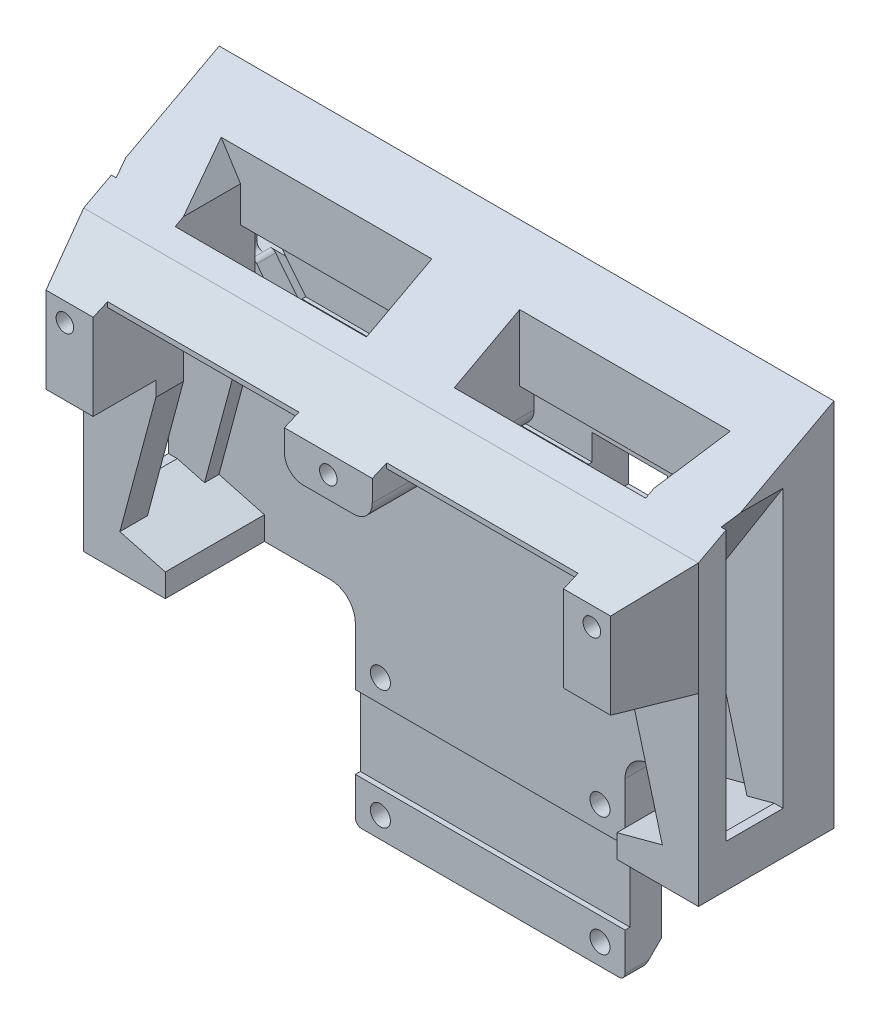
from build123d import *

# Parameters (mm, degrees)
EXTRUDE_1_DEPTH      = 10
EXTRUDE_7_DEPTH      = 11.6
FILLET_4_R           = 4
EXTRUDE_12_REACH     = 142.896
CUT_EXTRUDE_1_DEPTH  = 98
CUT_EXTRUDE_2_DEPTH  = 7.2
CUT_EXTRUDE_START    = -1.9
CUT_EXTRUDE_3_DEPTH  = 1.9
CUT_EXTRUDE_4_DEPTH  = 2.3
CUT_EXTRUDE_5_DEPTH  = 35
SKETCH_19_W          = 12
SKETCH_19_H          = 10
CUT_EXTRUDE_6_DEPTH  = 10
CUT_EXTRUDE_START_2  = -98
CUT_EXTRUDE_9_DEPTH  = 98
SKETCH_21_W          = 11
SKETCH_21_H          = 16
CUT_EXTRUDE_10_DEPTH = 4
SKETCH_22_W          = 4
SKETCH_22_H          = 6
CUT_EXTRUDE_11_DEPTH = 1.8
CUT_EXTRUDE_12_DEPTH = 3
FILLET_5_R           = 2
SKETCH_25_R          = 1.4
SKETCH_25_R_2        = 1.5
CUT_EXTRUDE_14_DEPTH = 5
FILLET_7_R           = 3
FILLET_8_R           = 1
FILLET_9_R           = 1
SKETCH_26_W          = 57.254707828
SKETCH_26_H          = 60.630906816
CUT_EXTRUDE_15_DEPTH = 34
SKETCH_27_W          = 38.751379921
SKETCH_27_H          = 18.149380469
CUT_EXTRUDE_16_DEPTH = 90
SKETCH_28_W          = 43
SKETCH_28_H          = 11.7
CUT_EXTRUDE_17_DEPTH = 0.8
SKETCH_29_R          = 1.6
CUT_EXTRUDE_18_DEPTH = 10
SKETCH_30_R          = 3.1
CUT_EXTRUDE_19_DEPTH = 3
CUT_EXTRUDE_20_REACH = 122.97
EXTRUDE_START        = 10
SKETCH_32_R          = 1.4
EXTRUDE_13_DEPTH     = 10
CUT_EXTRUDE_21_DEPTH = 105
SKETCH_35_W          = 11.6
SKETCH_35_H          = 2.5
EXTRUDE_14_DEPTH     = 13.009720114
SKETCH_36_W          = 11.6
SKETCH_36_H          = 2.5
EXTRUDE_15_DEPTH     = 13.009720114
CUT_EXTRUDE_23_DEPTH = 22
FILLET_10_R          = 1
SKETCH_41_W          = 26.831763834
SKETCH_41_H          = 0.8
EXTRUDE_16_DEPTH     = 0.4
SKETCH_42_W          = 30.5
SKETCH_42_H          = 4.57900939
CUT_EXTRUDE_26_DEPTH = 12
SKETCH_43_W          = 30.5
SKETCH_43_H          = 0.8
EXTRUDE_17_DEPTH     = 11.089944
SKETCH_44_W          = 30.5
SKETCH_44_H          = 0.8
EXTRUDE_18_DEPTH     = 11.089944
CUT_EXTRUDE_27_REACH = 114.234
EXTRUDE_19_DEPTH     = 0.6


# Read off the part's stored shape, not the designer's step: Вырез-Вытянуть2, Вырез-Вытянуть3
with BuildPart() as part:
    # Эскиз1 → Бобышка-Вытянуть1 (new body)
    with BuildSketch(Plane.XY):
        with BuildLine():
            Line((21.5, 0), (-21.5, 0))
            Line((-21.5, 0), (-21.5, 32.9))
            ThreePointArc((-21.5, 32.9), (-22.671572875, 35.728427125), (-25.5, 36.9))
            Line((-25.5, 36.9), (-49, 36.9))
            Line((-49, 36.9), (-49, 98.9))
            Line((-49, 98.9), (0, 98.9))
            Line((0, 98.9), (49, 98.9))
            Line((49, 98.9), (49, 36.9))
            Line((49, 36.9), (25.5, 36.9))
            ThreePointArc((25.5, 36.9), (22.671572875, 35.728427125), (21.5, 32.9))
            Line((21.5, 32.9), (21.5, 0))
        make_face()
    extrude(amount=EXTRUDE_1_DEPTH)

    # Эскиз11 → Бобышка-Вытянуть7 (add)
    with BuildSketch(Plane.XY.offset(10)):
        Polygon((21.553165826, 42.9), (-21.553165826, 42.9), (-21.553165826, 39.55), (-16, 39.55), (-16, 34.55), (16, 34.55), (16, 39.55), (21.553165826, 39.55), align=None)
    extrude(amount=EXTRUDE_7_DEPTH)

    # Скругление4
    fillet_4_edges = [part.edges().sort_by_distance(p)[0] for p in [
        (21.5, 0, 5),
        (-21.5, 0, 5),
    ]]
    fillet(fillet_4_edges, radius=FILLET_4_R)

    # Бобышка-Вытянуть12: up to this face of the body (flat: up to its plane)
    extrude_12_end = Plane(part.part.faces().sort_by_distance((49, 67.9, 5))[0])
    # Эскиз15 → Бобышка-Вытянуть12 (add, up to the picked face)
    with BuildSketch(Plane.ZY.offset(49), mode=Mode.PRIVATE) as extrude_12_sk1:
        Polygon((10, 92.154914832), (21.6, 84.330616036), (21.6, 39.4), (10, 39.4), align=None)
    extrude_12_tool1 = split(extrude(extrude_12_sk1.sketch, amount=-EXTRUDE_12_REACH, mode=Mode.PRIVATE), bisect_by=extrude_12_end, keep=Keep.BOTH, mode=Mode.PRIVATE)
    add(extrude_12_tool1.solids().sort_by(Axis((-49, 63.873608, 15.645146), (1, 0, 0)))[0])

    # Эскиз16 → Вырез-Вытянуть1 (cut)
    with BuildSketch(Plane.ZY.offset(49)):
        Polygon((0, 98.9), (10, 92.154914832), (12.130281991, 92.154914832), (12.130281991, 101.596000438), (0, 101.596000438), align=None)
    extrude(amount=-CUT_EXTRUDE_1_DEPTH, mode=Mode.SUBTRACT)

    # Вырез-Вытянуть2 outline → Вырез-Вытянуть2 (cut)
    with BuildSketch(Plane.XY.offset(10)):
        Polygon((7, 74.682330798), (37.5, 74.682330798), (37.5, 86.682330798), (51.448996139, 108.780541488), (7, 108.780541488), align=None)
        Polygon((35.990279886, 40.593813782), (47.581389801, 43.699642323), (49, 43.699642323), (49, 87.913527677), (39.687408926, 73.160380025), (27.264094761, 73.160380025), align=None)
        Polygon((-47.581389801, 43.699642323), (-35.990279886, 40.593813782), (-27.264094761, 73.160380025), (-39.687408926, 73.160380025), (-49, 87.913527677), (-49, 43.699642323), align=None)
        Polygon((-7, 108.780541488), (-51.448996139, 108.780541488), (-37.5, 86.682330798), (-37.5, 74.682330798), (-7, 74.682330798), align=None)
    extrude(amount=CUT_EXTRUDE_2_DEPTH, mode=Mode.SUBTRACT)

    # Вырез-Вытянуть3 outline → Вырез-Вытянуть3 (cut)
    with BuildSketch(Plane.XY.offset(10).offset(CUT_EXTRUDE_START)):
        Polygon((7, 74.682330798), (37.5, 74.682330798), (37.5, 86.682330798), (51.448996139, 108.780541488), (7, 108.780541488), align=None)
        Polygon((35.990279886, 40.593813782), (47.581389801, 43.699642323), (53.004518146, 43.699642323), (53.004518146, 94.2575459), (39.687408926, 73.160380025), (27.264094761, 73.160380025), align=None)
        Polygon((-47.581389801, 43.699642323), (-35.990279886, 40.593813782), (-27.264094761, 73.160380025), (-39.687408926, 73.160380025), (-53.004518146, 94.2575459), (-53.004518146, 43.699642323), align=None)
        Polygon((-7, 108.780541488), (-51.448996139, 108.780541488), (-37.5, 86.682330798), (-37.5, 74.682330798), (-7, 74.682330798), align=None)
    extrude(amount=CUT_EXTRUDE_3_DEPTH, mode=Mode.SUBTRACT)

    # Эскиз18 → Вырез-Вытянуть4 (cut)
    with BuildSketch(Plane.XY.offset(8.1)):
        Polygon((7, 81), (37.5, 81), (37.5, 63.9372364), (43.234723583, 42.53495662), (35.990279886, 40.593813782), (35.990279886, 33.432094285), (16, 33.432094285), (16, 42.55), (-16, 42.55), (-16, 33.432094285), (-35.990279886, 33.432094285), (-35.990279886, 40.593813782), (-43.234723583, 42.53495662), (-37.5, 63.9372364), (-37.5, 81), (-7, 81), (-7, 73.58), (7, 73.58), align=None)
    extrude(amount=-CUT_EXTRUDE_4_DEPTH, mode=Mode.SUBTRACT)

    # Эскиз18 → Вырез-Вытянуть5 (cut)
    with BuildSketch(Plane.XY.offset(8.1)):
        Polygon((7, 81), (37.5, 81), (37.5, 63.9372364), (43.234723583, 42.53495662), (35.990279886, 40.593813782), (35.990279886, 33.432094285), (16, 33.432094285), (16, 42.55), (-16, 42.55), (-16, 33.432094285), (-35.990279886, 33.432094285), (-35.990279886, 40.593813782), (-43.234723583, 42.53495662), (-37.5, 63.9372364), (-37.5, 81), (-7, 81), (-7, 73.58), (7, 73.58), align=None)
    extrude(amount=CUT_EXTRUDE_5_DEPTH, mode=Mode.SUBTRACT)

    # Эскиз19 → Вырез-Вытянуть6 (cut)
    with BuildSketch(Plane.XY.offset(5.8)):
        Polygon((32.42222683, 61.637375681), (34.354078483, 62.155013771), (37.459907024, 50.563903856), (35.528055371, 50.046265766), (28.283611674, 48.105122927), (25.177783133, 59.696232843), align=None)
        with Locations((22.25, 73.08)):
            Rectangle(SKETCH_19_W, SKETCH_19_H)
    extrude(amount=-CUT_EXTRUDE_6_DEPTH, mode=Mode.SUBTRACT)

    # Эскиз20 → Вырез-Вытянуть9 (cut)
    with BuildSketch(Plane.ZY.offset(49).offset(CUT_EXTRUDE_START_2)):
        Polygon((0, 95.9), (21.6, 84.330616036), (21.6, 100.647071041), (-4.292074311, 100.647071041), (-4.292074311, 95.9), align=None)
    extrude(amount=CUT_EXTRUDE_9_DEPTH, mode=Mode.SUBTRACT)

    # Эскиз21 → Вырез-Вытянуть10 (cut)
    with BuildSketch(Plane(origin=(0, 0, 0), x_dir=(-1, 0, 0), z_dir=(0, 0, -1))):
        with Locations((40.5, 83)):
            Rectangle(SKETCH_21_W, SKETCH_21_H)
        with Locations((-40.5, 83)):
            Rectangle(SKETCH_21_W, SKETCH_21_H)
    extrude(amount=-CUT_EXTRUDE_10_DEPTH, mode=Mode.SUBTRACT)

    # Эскиз22 → Вырез-Вытянуть11 (cut)
    with BuildSketch(Plane(origin=(0, 0, 4), x_dir=(-1, 0, 0), z_dir=(0, 0, -1))):
        with Locations((37, 78)):
            Rectangle(SKETCH_22_W, SKETCH_22_H)
        with Locations((-37, 78)):
            Rectangle(SKETCH_22_W, SKETCH_22_H)
    extrude(amount=-CUT_EXTRUDE_11_DEPTH, mode=Mode.SUBTRACT)

    # Эскиз23 → Вырез-Вытянуть12 (cut)
    with BuildSketch(Plane.XY.offset(5.8)):
        Polygon((35, 75), (35, 81), (28.25, 72.541381211), (28.25, 68.08), (24.689806081, 68.08), (22.25, 65.022608954), (26.702577765, 61.469440209), (37.5, 75), align=None)
        Polygon((-35, 81), (-22.25, 65.022608954), (-26.702577765, 61.469440209), (-37.5, 75), (-35, 75), align=None)
    extrude(amount=-CUT_EXTRUDE_12_DEPTH, mode=Mode.SUBTRACT)

    # Скругление5
    fillet_5_edges = [part.edges().sort_by_distance(p)[0] for p in [
        (24.476288882, 63.246024582, 2.8),
        (-24.476288882, 63.246024582, 2.8),
    ]]
    fillet(fillet_5_edges, radius=FILLET_5_R)

    # Эскиз25 → Вырез-Вытянуть14 (cut)
    with BuildSketch(Plane.XY.offset(21.6)):
        with Locations((-42, 77)):
            Circle(SKETCH_25_R)
        with Locations((0, 77)):
            Circle(SKETCH_25_R)
        with Locations((-11, 7.5)):
            Circle(SKETCH_25_R_2)
        with Locations((11, 7.5)):
            Circle(SKETCH_25_R_2)
        with Locations(Location((42, 77, 0), (0, 0, 53.891575988))):
            Circle(SKETCH_25_R)
    extrude(amount=-CUT_EXTRUDE_14_DEPTH, mode=Mode.SUBTRACT)

    # Скругление7
    fillet_7_edges = [part.edges().sort_by_distance(p)[0] for p in [
        (7, 73.58, 13.7),
        (-7, 73.58, 13.7),
    ]]
    fillet(fillet_7_edges, radius=FILLET_7_R)

    # Скругление8
    # the kernel refuses this fillet: 1 mm, written as the material it adds along each edge
    with BuildSketch(Plane(origin=(35, 81, 4), x_dir=(1, 0, 0), z_dir=(0, 0, 1))) as fillet_8_piece_1:
        with BuildLine():
            CenterArc((FILLET_8_R * 0.481375422806, -FILLET_8_R), FILLET_8_R, 90, 51.41004095)
            Line((-FILLET_8_R * 0.30025437104, -FILLET_8_R * 0.37625737249), (0, 0))
            Line((0, 0), (FILLET_8_R * 0.481375422806, 0))
        make_face()
    extrude(amount=1.8)
    with BuildSketch(Plane(origin=(39, 81, 4), x_dir=(-1, 0, 0), z_dir=(0, 0, 1))) as fillet_8_piece_2:
        with BuildLine():
            CenterArc((FILLET_8_R, FILLET_8_R), FILLET_8_R, 180, 90)
            Line((0, FILLET_8_R), (0, 0))
            Line((0, 0), (FILLET_8_R, 0))
        make_face()
    extrude(amount=4.3)
    with BuildSketch(Plane(origin=(35, 75, 0), x_dir=(0, 1, 0), z_dir=(0, 0, 1))) as fillet_8_piece_3:
        with BuildLine():
            CenterArc((FILLET_8_R, -FILLET_8_R), FILLET_8_R, 90, 90)
            Line((0, -FILLET_8_R), (0, 0))
            Line((0, 0), (FILLET_8_R, 0))
        make_face()
    extrude(amount=2.8)
    with BuildSketch(Plane(origin=(46, 75, 0), x_dir=(-1, 0, 0), z_dir=(0, 0, 1))) as fillet_8_piece_4:
        with BuildLine():
            CenterArc((FILLET_8_R, -FILLET_8_R), FILLET_8_R, 90, 90)
            Line((0, -FILLET_8_R), (0, 0))
            Line((0, 0), (FILLET_8_R, 0))
        make_face()
    extrude(amount=6.5)
    with BuildSketch(Plane(origin=(35, 91, 0), x_dir=(0, -1, 0), z_dir=(0, 0, 1)), Plane(origin=(46, 91, 0), x_dir=(-1, 0, 0), z_dir=(0, 0, 1))) as fillet_8_piece_5:
        with BuildLine():
            CenterArc((FILLET_8_R, FILLET_8_R), FILLET_8_R, 180, 90)
            Line((0, FILLET_8_R), (0, 0))
            Line((0, 0), (FILLET_8_R, 0))
        make_face()
    extrude(amount=6.5)
    # the kernel refuses this fillet: 1 mm, written as the material it takes off along each edge
    with BuildSketch(Plane(origin=(37.5, 75, 5.8), x_dir=(1, 0, 0), z_dir=(0, 0, -1))) as fillet_8_2_piece_1:
        with BuildLine():
            CenterArc((FILLET_8_R * 0.481375422806, FILLET_8_R), FILLET_8_R, 218.58995905, 51.41004095)
            Line((-FILLET_8_R * 0.30025437104, FILLET_8_R * 0.37625737249), (0, 0))
            Line((0, 0), (FILLET_8_R * 0.481375422806, 0))
        make_face()
    extrude(amount=3, mode=Mode.SUBTRACT)

    # Скругление9
    # the kernel refuses this fillet: 1 mm, written as the material it adds along each edge
    with BuildSketch(Plane(origin=(39, 75, 4), x_dir=(-1, 0, 0), z_dir=(0, 0, 1)), Plane(origin=(-39, 81, 4), x_dir=(1, 0, 0), z_dir=(0, 0, 1))) as fillet_9_piece_1:
        with BuildLine():
            CenterArc((FILLET_9_R, -FILLET_9_R), FILLET_9_R, 90, 90)
            Line((0, -FILLET_9_R), (0, 0))
            Line((0, 0), (FILLET_9_R, 0))
        make_face()
    extrude(amount=4.3)
    with BuildSketch(Plane(origin=(-35, 81, 4), x_dir=(-1, 0, 0), z_dir=(0, 0, 1))) as fillet_9_piece_2:
        with BuildLine():
            CenterArc((FILLET_9_R * 0.481375422806, FILLET_9_R), FILLET_9_R, 218.58995905, 51.41004095)
            Line((-FILLET_9_R * 0.30025437104, FILLET_9_R * 0.37625737249), (0, 0))
            Line((0, 0), (FILLET_9_R * 0.481375422806, 0))
        make_face()
    extrude(amount=1.8)
    with BuildSketch(Plane(origin=(-39, 75, 4), x_dir=(1, 0, 0), z_dir=(0, 0, 1))) as fillet_9_piece_3:
        with BuildLine():
            CenterArc((FILLET_9_R, FILLET_9_R), FILLET_9_R, 180, 90)
            Line((0, FILLET_9_R), (0, 0))
            Line((0, 0), (FILLET_9_R, 0))
        make_face()
    extrude(amount=4.3)
    with BuildSketch(Plane(origin=(-35, 75, 2.8), x_dir=(0, 1, 0), z_dir=(0, 0, -1))) as fillet_9_piece_4:
        with BuildLine():
            CenterArc((FILLET_9_R, -FILLET_9_R), FILLET_9_R, 90, 90)
            Line((0, -FILLET_9_R), (0, 0))
            Line((0, 0), (FILLET_9_R, 0))
        make_face()
    extrude(amount=2.8)
    with BuildSketch(Plane(origin=(-46, 75, 0), x_dir=(0, 1, 0), z_dir=(0, 0, 1)), Plane(origin=(-35, 91, 0), x_dir=(0, -1, 0), z_dir=(0, 0, 1)), Plane(origin=(-46, 91, 0), x_dir=(1, 0, 0), z_dir=(0, 0, 1))) as fillet_9_piece_5:
        with BuildLine():
            CenterArc((FILLET_9_R, -FILLET_9_R), FILLET_9_R, 90, 90)
            Line((0, -FILLET_9_R), (0, 0))
            Line((0, 0), (FILLET_9_R, 0))
        make_face()
    extrude(amount=6.5)
    # the kernel refuses this fillet: 1 mm, written as the material it takes off along each edge
    with BuildSketch(Plane(origin=(-37.5, 75, 5.8), x_dir=(0.6237426275100024, -0.7816297938454742, 0), z_dir=(0, 0, -1))) as fillet_9_2_piece_1:
        with BuildLine():
            CenterArc((FILLET_9_R * 0.481375422806, FILLET_9_R), FILLET_9_R, 218.58995905, 51.41004095)
            Line((-FILLET_9_R * 0.30025437104, FILLET_9_R * 0.37625737249), (0, 0))
            Line((0, 0), (FILLET_9_R * 0.481375422806, 0))
        make_face()
    extrude(amount=3, mode=Mode.SUBTRACT)

    # Эскиз26 → Вырез-Вытянуть15 (cut)
    with BuildSketch(Plane.XY.offset(5.8)):
        with Locations((-0.102842525, 19.886105374)):
            Rectangle(SKETCH_26_W, SKETCH_26_H)
    extrude(amount=CUT_EXTRUDE_15_DEPTH, mode=Mode.SUBTRACT)

    # Эскиз27 → Вырез-Вытянуть16 (cut)
    with BuildSketch(Plane.ZY.offset(49)):
        with Locations((2.605864859, -4.074690235)):
            Rectangle(SKETCH_27_W, SKETCH_27_H)
    extrude(amount=-CUT_EXTRUDE_16_DEPTH, mode=Mode.SUBTRACT)

    # Эскиз28 → Вырез-Вытянуть17 (cut)
    with BuildSketch(Plane.XY.offset(5.8)):
        with Locations((0, 17.85)):
            Rectangle(SKETCH_28_W, SKETCH_28_H)
    extrude(amount=-CUT_EXTRUDE_17_DEPTH, mode=Mode.SUBTRACT)

    # Эскиз29 → Вырез-Вытянуть18 (cut)
    with BuildSketch(Plane.XY.offset(5.8)):
        with Locations((-17.5, 27.35)):
            Circle(SKETCH_29_R)
        with Locations(Location((-17.5, 8.35, 0), (0, 0, 180))):
            Circle(SKETCH_29_R)
        with Locations((17.5, 8.35)):
            Circle(SKETCH_29_R)
        with Locations(Location((17.5, 27.35, 0), (0, 0, 180))):
            Circle(SKETCH_29_R)
    extrude(amount=-CUT_EXTRUDE_18_DEPTH, mode=Mode.SUBTRACT)

    # Эскиз30 → Вырез-Вытянуть19 (cut)
    with BuildSketch(Plane(origin=(0, 0, 0), x_dir=(-1, 0, 0), z_dir=(0, 0, -1))):
        with Locations((-17.5, 27.35)):
            Circle(SKETCH_30_R)
        with Locations((17.5, 27.35)):
            Circle(SKETCH_30_R)
        with BuildLine():
            Line((-19.1, 4.073439662), (-19.1, 5.425961697))
            ThreePointArc((-19.1, 5.425961697), (-19.155121739, 5.654179429), (-19.308333333, 5.832078128))
            ThreePointArc((-19.308333333, 5.832078128), (-17.5, 11.45), (-15.691666667, 5.832078128))
            ThreePointArc((-15.691666667, 5.832078128), (-15.844878261, 5.654179429), (-15.9, 5.425961697))
            Line((-15.9, 5.425961697), (-15.9, 4.073439662))
            Line((-15.9, 4.073439662), (-19.1, 4.073439662))
        make_face()
        with BuildLine():
            Line((19.1, 4.073439662), (19.1, 5.425961697))
            ThreePointArc((19.1, 5.425961697), (19.155121739, 5.654179429), (19.308333333, 5.832078128))
            ThreePointArc((19.308333333, 5.832078128), (17.5, 11.45), (15.691666667, 5.832078128))
            ThreePointArc((15.691666667, 5.832078128), (15.844878261, 5.654179429), (15.9, 5.425961697))
            Line((15.9, 5.425961697), (15.9, 4.073439662))
            Line((15.9, 4.073439662), (19.1, 4.073439662))
        make_face()
    extrude(amount=-CUT_EXTRUDE_19_DEPTH, mode=Mode.SUBTRACT)

    # Вырез-Вытянуть20: up to this face of the body (flat: up to its plane)
    cut_extrude_20_end = Plane(part.part.faces().sort_by_distance((21.5, 19.017532468, 2.746517119))[0])
    # Эскиз31 → Вырез-Вытянуть20 (cut, up to the picked face)
    with BuildSketch(Plane.ZY.offset(21.5), mode=Mode.PRIVATE) as cut_extrude_20_sk1:
        Polygon((3, 5), (0, 8), (0, 5), align=None)
    cut_extrude_20_tool1 = split(extrude(cut_extrude_20_sk1.sketch, amount=-CUT_EXTRUDE_20_REACH, mode=Mode.PRIVATE), bisect_by=cut_extrude_20_end, keep=Keep.BOTH, mode=Mode.PRIVATE)
    add(cut_extrude_20_tool1.solids().sort_by(Axis((-21.5, 6, 1), (1, 0, 0)))[0], mode=Mode.SUBTRACT)

    # Эскиз32 → Бобышка-Вытянуть13 (add)
    with BuildSketch(Plane.XY.offset(21.6).offset(EXTRUDE_START)):
        with BuildLine():
            Line((-49, 66.304036505), (-37.5, 66.304036505))
            Line((-37.5, 66.304036505), (-37.5, 81))
            Line((-37.5, 81), (-7, 81))
            Line((-7, 81), (-7, 76.58))
            ThreePointArc((-7, 76.58), (-6.121320344, 74.458679656), (-4, 73.58))
            Line((-4, 73.58), (4, 73.58))
            ThreePointArc((4, 73.58), (6.121320344, 74.458679656), (7, 76.58))
            Line((7, 76.58), (7, 81))
            Line((7, 81), (37.5, 81))
            Line((37.5, 81), (37.5, 66.304036505))
            Line((37.5, 66.304036505), (49, 66.304036505))
            Line((49, 66.304036505), (49, 84.330616036))
            Line((49, 84.330616036), (-49, 84.330616036))
            Line((-49, 84.330616036), (-49, 66.304036505))
        make_face()
        with Locations((-42, 77)):
            Circle(SKETCH_32_R, mode=Mode.SUBTRACT)
        with Locations((0, 77)):
            Circle(SKETCH_32_R, mode=Mode.SUBTRACT)
        with Locations((42, 77)):
            Circle(SKETCH_32_R, mode=Mode.SUBTRACT)
    extrude(amount=-EXTRUDE_13_DEPTH)

    # Эскиз33 → Вырез-Вытянуть21 (cut)
    with BuildSketch(Plane.ZY.offset(49)):
        Polygon((21.6, 84.330616036), (31.6, 80.000616036), (31.6, 84.330616036), align=None)
    extrude(amount=-CUT_EXTRUDE_21_DEPTH, mode=Mode.SUBTRACT)

    # Эскиз35 → Бобышка-Вытянуть14 (add)
    with BuildSketch(Plane(origin=(49, 0, 0), x_dir=(0, 0, -1), z_dir=(1, 0, 0))):
        with Locations((-15.8, 38.15)):
            Rectangle(SKETCH_35_W, SKETCH_35_H)
    extrude(amount=-EXTRUDE_14_DEPTH)

    # Эскиз36 → Бобышка-Вытянуть15 (add)
    with BuildSketch(Plane.ZY.offset(49)):
        with Locations((15.8, 38.15)):
            Rectangle(SKETCH_36_W, SKETCH_36_H)
    extrude(amount=-EXTRUDE_15_DEPTH)

    # Эскиз37 → Вырез-Вытянуть23 (cut)
    with BuildSketch(Plane.XZ.offset(-66.304036505)):
        Polygon((49, 21.6), (45, 31.6), (49, 31.6), align=None)
        Polygon((-49, 31.6), (-49, 21.6), (-45, 31.6), align=None)
    extrude(amount=-CUT_EXTRUDE_23_DEPTH, mode=Mode.SUBTRACT)

    # Скругление10
    fillet_10_edges = [part.edges().sort_by_distance(p)[0] for p in [
        (-21.5, 5, 4.4),
        (21.5, 5, 4.4),
    ]]
    fillet(fillet_10_edges, radius=FILLET_10_R)

    # Эскиз41 → Бобышка-Вытянуть16 (add)
    with BuildSketch(Plane.XY.offset(5.8)):
        with Locations((20.415881917, 80.6)):
            Rectangle(SKETCH_41_W, SKETCH_41_H)
    extrude_16 = extrude(amount=EXTRUDE_16_DEPTH)

    # Эскиз42 → Вырез-Вытянуть26 (cut)
    with BuildSketch(Plane(origin=(0, 81.762107903, 5.187017227), x_dir=(-1, 0, 0), z_dir=(0, -0.9979937145832851, -0.06331307647126702))):
        with Locations((-22.25, -10.747628002)):
            Rectangle(SKETCH_42_W, SKETCH_42_H)
    cut_extrude_26 = extrude(amount=-CUT_EXTRUDE_26_DEPTH, mode=Mode.SUBTRACT)

    # Эскиз43 → Бобышка-Вытянуть17 (add)
    with BuildSketch(Plane.XY.offset(18.202010319)):
        with Locations((22.25, 80.6)):
            Rectangle(SKETCH_43_W, SKETCH_43_H)
    extrude(amount=EXTRUDE_17_DEPTH)

    # Зеркальное отражение11: Бобышка-Вытянуть16 across plane
    add(extrude_16.mirror(Plane(origin=(0, 0, 0), x_dir=(0, 0, 1), z_dir=(1, 0, 0))))

    # Зеркальное отражение12: Вырез-Вытянуть26 across plane
    add(cut_extrude_26.mirror(Plane(origin=(0, 0, 0), x_dir=(0, 0, 1), z_dir=(1, 0, 0))), mode=Mode.SUBTRACT)

    # Эскиз44 → Бобышка-Вытянуть18 (add)
    with BuildSketch(Plane.XY.offset(18.202010319)):
        with Locations((-22.25, 80.6)):
            Rectangle(SKETCH_44_W, SKETCH_44_H)
    extrude(amount=EXTRUDE_18_DEPTH)

    # Вырез-Вытянуть27: up to this face of the body (flat: up to its plane)
    cut_extrude_27_end = Plane(part.part.faces().sort_by_distance((-41.039784767, 83.764843234, 4))[0])
    # Эскиз45 → Вырез-Вытянуть27 (cut, up to the picked face)
    with BuildSketch(Plane(origin=(0, 0, 0), x_dir=(-1, 0, 0), z_dir=(0, 0, -1)), mode=Mode.PRIVATE) as cut_extrude_27_sk1:
        with BuildLine():
            Line((-36, 91), (-34, 91))
            ThreePointArc((-34, 91), (-33.292893219, 90.707106781), (-33, 90))
            Line((-33, 90), (-33, 76))
            ThreePointArc((-33, 76), (-33.292893219, 75.292893219), (-34, 75))
            Line((-34, 75), (-36, 75))
            Line((-36, 75), (-36, 91))
        make_face()
    cut_extrude_27_tool1 = split(extrude(cut_extrude_27_sk1.sketch, amount=-CUT_EXTRUDE_27_REACH, mode=Mode.PRIVATE), bisect_by=cut_extrude_27_end, keep=Keep.BOTH, mode=Mode.PRIVATE)
    # Эскиз45 → Вырез-Вытянуть27 (cut, up to the picked face)
    with BuildSketch(Plane(origin=(0, 0, 0), x_dir=(-1, 0, 0), z_dir=(0, 0, -1)), mode=Mode.PRIVATE) as cut_extrude_27_sk2:
        with BuildLine():
            Line((36, 91), (36, 75))
            Line((36, 75), (34, 75))
            ThreePointArc((34, 75), (33.292893219, 75.292893219), (33, 76))
            Line((33, 76), (33, 90))
            ThreePointArc((33, 90), (33.292893219, 90.707106781), (34, 91))
            Line((34, 91), (36, 91))
        make_face()
    cut_extrude_27_tool2 = split(extrude(cut_extrude_27_sk2.sketch, amount=-CUT_EXTRUDE_27_REACH, mode=Mode.PRIVATE), bisect_by=cut_extrude_27_end, keep=Keep.BOTH, mode=Mode.PRIVATE)
    add(cut_extrude_27_tool1.solids().sort_by(Axis((34.511518, 83, 0), (0, 0, 1)))[0], mode=Mode.SUBTRACT)
    add(cut_extrude_27_tool2.solids().sort_by(Axis((-34.511518, 83, 0), (0, 0, 1)))[0], mode=Mode.SUBTRACT)

    # Эскиз46 → Бобышка-Вытянуть19 (add)
    with BuildSketch(Plane.XY.offset(5.8)):
        Polygon((-29.39802157, 73.98), (16.25, 73.98), (16.25, 73.18), (-28.75961947, 73.18), align=None)
    extrude(amount=EXTRUDE_19_DEPTH)


solid = part.part
